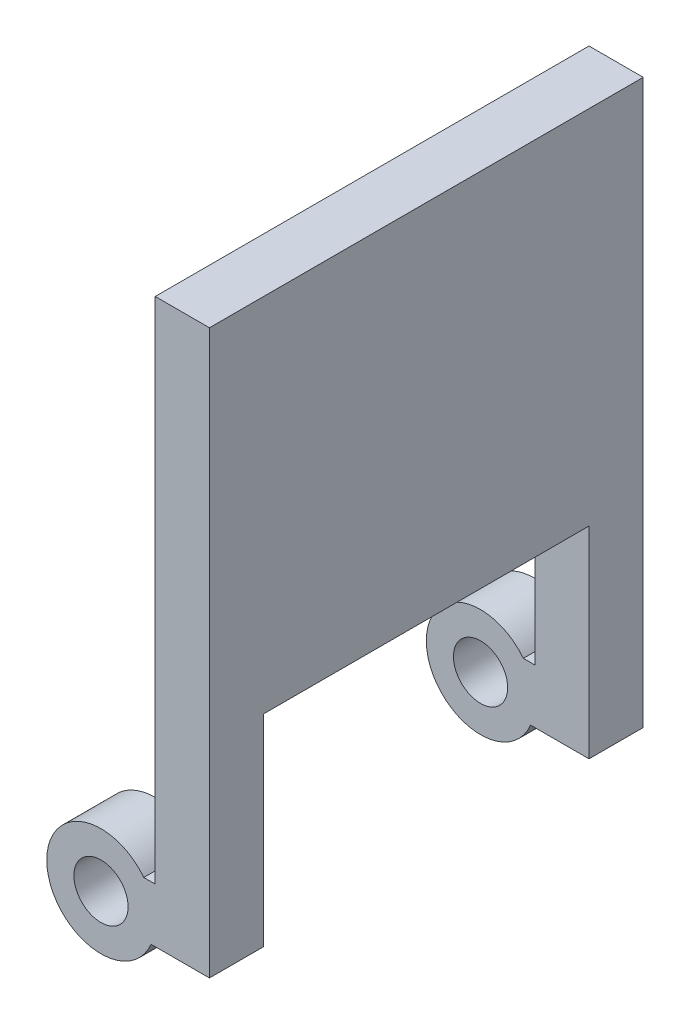
from build123d import *

# Parameters (mm, degrees)
CROQUIS1_R              = 3
SALIENTE_EXTRUIR1_DEPTH = 6
CROQUIS2_W              = 6
CROQUIS2_H              = 40
SALIENTE_EXTRUIR2_DEPTH = 36
CROQUIS3_R              = 3
SALIENTE_EXTRUIR3_DEPTH = 6


with BuildPart() as part:
    # Croquis1 → Saliente-Extruir1 (new body)
    with BuildSketch(Plane.XY):
        with BuildLine():
            Line((9, 60), (6, 60))
            Line((6, 60), (6, 3.687975807))
            Line((6, 3.687975807), (4.732740691, 3.687975807))
            ThreePointArc((4.732740691, 3.687975807), (-5.946857985, -0.796793639), (5.536654597, -2.312024193))
            Line((5.536654597, -2.312024193), (12, -2.312024193))
            Line((12, -2.312024193), (12, 54.803847577))
            Line((12, 54.803847577), (12, 60))
            Line((12, 60), (9, 60))
        make_face()
        Circle(CROQUIS1_R, mode=Mode.SUBTRACT)
    extrude(amount=SALIENTE_EXTRUIR1_DEPTH)

    # Croquis2 → Saliente-Extruir2 (add)
    with BuildSketch(Plane.XY.offset(6)):
        with Locations((9, 40)):
            Rectangle(CROQUIS2_W, CROQUIS2_H)
    extrude(amount=SALIENTE_EXTRUIR2_DEPTH)

    # Croquis3 → Saliente-Extruir3 (add)
    with BuildSketch(Plane.XY.offset(42)):
        with BuildLine():
            Line((5.536654597, -2.312024193), (12, -2.312024193))
            Line((12, -2.312024193), (12, 60))
            Line((12, 60), (6, 60))
            Line((6, 60), (6, 3.687975807))
            Line((6, 3.687975807), (4.732740691, 3.687975807))
            ThreePointArc((4.732740691, 3.687975807), (-5.946857985, -0.796793639), (5.536654597, -2.312024193))
        make_face()
        Circle(CROQUIS3_R, mode=Mode.SUBTRACT)
    extrude(amount=SALIENTE_EXTRUIR3_DEPTH)


solid = part.part
